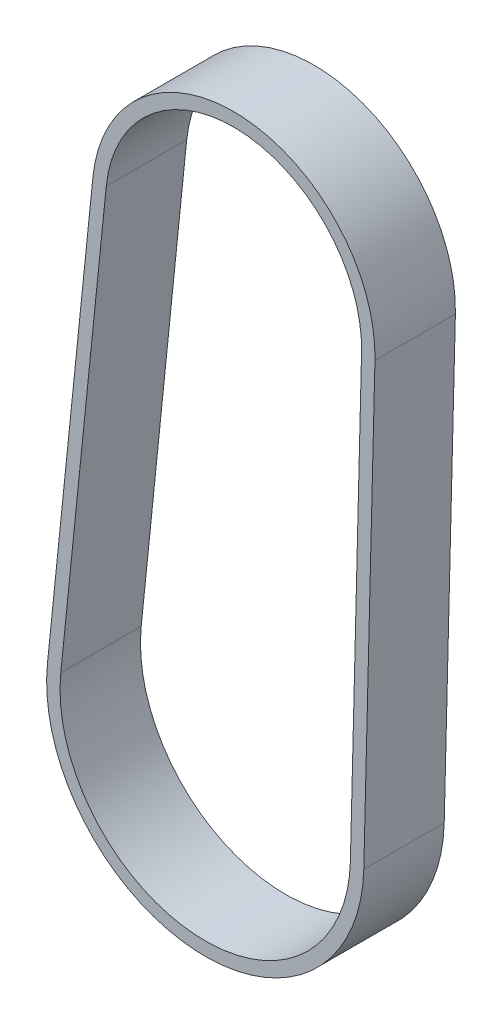
from build123d import *

# Parameters (mm, degrees)
EXTRUDE_THIN1_DEPTH = 9


with BuildPart() as part:
    # Sketch2 → Extrude-Thin1 (new body)
    with BuildSketch(Plane.XY):
        with BuildLine():
            Line((15.818995359, -0.395749089), (14.569448036, -50.343010707))
            ThreePointArc((14.569448036, -50.343010707), (-4.302125, -67.613269559), (-20.832611841, -48.090433841))
            Line((-20.832611841, -48.090433841), (-15.741581772, 1.612400328))
            ThreePointArc((-15.741581772, 1.612400328), (1.0048205, 15.792009602), (15.818995359, -0.395749089))
        make_face()
        with BuildLine():
            Line((14.319464539, -0.358234826), (13.069917216, -50.305496444))
            ThreePointArc((13.069917216, -50.305496444), (-4.206875, -66.116296801), (-19.340419291, -48.243278187))
            Line((-19.340419291, -48.243278187), (-14.249389222, 1.459555983))
            ThreePointArc((-14.249389222, 1.459555983), (0.9095705, 14.295036844), (14.319464539, -0.358234826))
        make_face(mode=Mode.SUBTRACT)
    extrude(amount=EXTRUDE_THIN1_DEPTH)


solid = part.part
